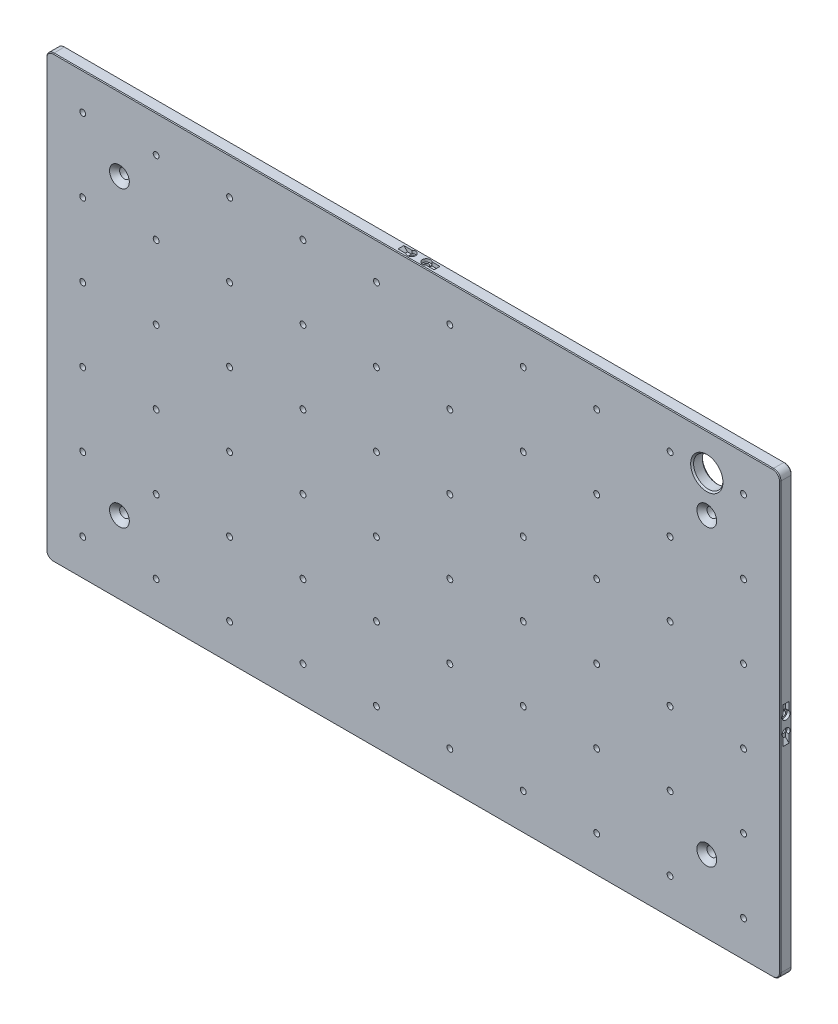
from build123d import *

# Parameters (mm, degrees)
SKETCH_1_W                  = 500
SKETCH_1_H                  = 300
EXTRUDE_1_DEPTH             = 8
HOLE_WIZARD_1_D             = 4
PATTERN_LINEAR_1_COUNT      = 10
PATTERN_LINEAR_1_PITCH      = 50
PATTERN_LINEAR_1_COUNT_DIR2 = 6
PATTERN_LINEAR_1_PITCH_DIR2 = 50
HOLE_WIZARD_2_D             = 6.6
HOLE_WIZARD_2_CSINK_D       = 13.44
HOLE_WIZARD_2_CSINK_ANGLE   = 90
PATTERN_LINEAR_2_COUNT      = 2
PATTERN_LINEAR_2_PITCH      = 400
PATTERN_LINEAR_2_COUNT_DIR2 = 2
PATTERN_LINEAR_2_PITCH_DIR2 = 200
HOLE_WIZARD_3_D             = 20
CHAMFER_1_SIZE              = 1
SKETCH_10_W                 = 1.6
SKETCH_10_H                 = 15
SKETCH_11_W                 = 6.5
SKETCH_11_H                 = 6.5
CUT_EXTRUDE_1_DEPTH         = 12
SKETCH_13_W                 = 2.7
SKETCH_13_H                 = 2
SKETCH_15_W                 = 3
SKETCH_15_H                 = 4
CUT_EXTRUDE_3_DEPTH         = 2.5
CHAMFER_3_SIZE              = 2.5
CHAMFER_3_OF_MIRROR_14_SIZE = 2.5
HOLE_WIZARD_6_D             = 5.4
HOLE_WIZARD_6_DEPTH         = 2
HOLE_WIZARD_7_D             = 3.2
HOLE_WIZARD_7_DEPTH         = 15
SKETCH_21_W                 = 3
SKETCH_21_H                 = 4
CUT_EXTRUDE_4_DEPTH         = 2.5
CHAMFER_4_SIZE              = 2.5
SKETCH_22_W                 = 6.5
SKETCH_22_H                 = 6.5
CUT_EXTRUDE_5_DEPTH         = 12
SKETCH_24_R                 = 1.6
CUT_EXTRUDE_6_DEPTH         = 15
HOLE_WIZARD_8_D             = 5.4
HOLE_WIZARD_8_DEPTH         = 2
SKETCH_27_W                 = 4
SKETCH_27_H                 = 3
CUT_EXTRUDE_7_DEPTH         = 2.5
CHAMFER_5_SIZE              = 2.5
SKETCH_28_W                 = 6.5
SKETCH_28_H                 = 6.5
CUT_EXTRUDE_9_DEPTH         = 12
HOLE_WIZARD_9_D             = 5.4
HOLE_WIZARD_9_DEPTH         = 2
HOLE_WIZARD_10_D            = 3.2
HOLE_WIZARD_10_DEPTH        = 15
SKETCH_34_W                 = 4
SKETCH_34_H                 = 3
CUT_EXTRUDE_10_DEPTH        = 2.5
CHAMFER_6_SIZE              = 2.5
SKETCH_36_W                 = 6.5
SKETCH_36_H                 = 6.5
CUT_EXTRUDE_11_DEPTH        = 12
FILLET_2_R                  = 5
CHAMFER_7_SIZE              = 0.5


with BuildPart() as part:
    # 草图1 → 凸台-拉伸1 (new body)
    with BuildSketch(Plane.XY):
        Rectangle(SKETCH_1_W, SKETCH_1_H)
    extrude(amount=EXTRUDE_1_DEPTH)

    # 孔1 (through all)
    with Locations(Plane.XY.offset(8)):
        with Locations((-225, -125)):
            hole_wizard_1 = Hole(HOLE_WIZARD_1_D / 2)

    # 阵列(线性)1: Hole Wizard 1 10 × 6
    with Locations(*[(i * PATTERN_LINEAR_1_PITCH, j * PATTERN_LINEAR_1_PITCH_DIR2, 0) for i in range(PATTERN_LINEAR_1_COUNT) for j in range(PATTERN_LINEAR_1_COUNT_DIR2) if (i, j) != (0, 0)]):
        add(hole_wizard_1, mode=Mode.SUBTRACT)

    # 孔2 (through all)
    with Locations(Plane.XY.offset(8)):
        with Locations((-200, 100)):
            hole_wizard_2 = CounterSinkHole(HOLE_WIZARD_2_D / 2, HOLE_WIZARD_2_CSINK_D / 2, counter_sink_angle=HOLE_WIZARD_2_CSINK_ANGLE)

    # 阵列(线性)2: Hole Wizard 2 2 × 2
    with Locations(*[(i * PATTERN_LINEAR_2_PITCH, -j * PATTERN_LINEAR_2_PITCH_DIR2, 0) for i in range(PATTERN_LINEAR_2_COUNT) for j in range(PATTERN_LINEAR_2_COUNT_DIR2) if (i, j) != (0, 0)]):
        add(hole_wizard_2, mode=Mode.SUBTRACT)

    # 孔3 (through all)
    with Locations(Plane.XY.offset(8)):
        with Locations((200, 125)):
            Hole(HOLE_WIZARD_3_D / 2)

    # 倒角1
    chamfer_1_edges = [part.edges().sort_by_distance(p)[0] for p in [
        (210, 125, 8),
        (210, 125, 0),
    ]]
    chamfer(chamfer_1_edges, length=CHAMFER_1_SIZE)


with BuildPart() as body_2:
    # Split Bodies 1: the piece on the far side of the plane
    add(part.part)
    split(bisect_by=Plane(origin=(0, 0, 0), x_dir=(0, 0, 1), z_dir=(1, 0, 0)), keep=Keep.BOTTOM)


with BuildPart() as part_1:
    add(part.part)

    # Split Bodies 1
    split(bisect_by=Plane(origin=(0, 0, 0), x_dir=(0, 0, 1), z_dir=(1, 0, 0)), keep=Keep.TOP)


with BuildPart() as body_3:
    # Split Bodies 2: the piece on the far side of the plane
    add(part_1.part)
    split(bisect_by=Plane.ZX, keep=Keep.BOTTOM)


with BuildPart() as part_2:
    add(part_1.part)

    # Split Bodies 2
    split(bisect_by=Plane.ZX, keep=Keep.TOP)


with BuildPart() as body_4:
    # Split Bodies 3: the piece on the far side of the plane
    add(body_2.part)
    split(bisect_by=Plane.ZX, keep=Keep.BOTTOM)


with BuildPart() as body_2_1:
    add(body_2.part)

    # Split Bodies 3
    split(bisect_by=Plane.ZX, keep=Keep.TOP)

    # 草图10 → 孔4 (revolve, cut)
    with BuildSketch(Plane(origin=(-5, 150, 4), x_dir=(0, 0, 1), z_dir=(1, 0, 0))):
        with Locations((0.8, 7.5)):
            Rectangle(SKETCH_10_W, SKETCH_10_H)
    hole_wizard_4 = revolve(axis=Axis((-5, 40, 4), (0, 1, 0)), mode=Mode.SUBTRACT)

    # 草图11 → 切除-拉伸1 (cut)
    with BuildSketch(Plane(origin=(0, 0, 0), x_dir=(0, 0, -1), z_dir=(1, 0, 0))):
        with Locations((-4, 143)):
            Rectangle(SKETCH_11_W, SKETCH_11_H)
    cut_extrude_1 = extrude(amount=-CUT_EXTRUDE_1_DEPTH, mode=Mode.SUBTRACT)

    # Combine 1: union part
    add(part_2.part)

    # 镜向1: 孔4, 切除-拉伸1 across plane
    add(hole_wizard_4.mirror(Plane(origin=(0, 0, 0), x_dir=(0, 0, 1), z_dir=(1, 0, 0))), mode=Mode.SUBTRACT)
    add(cut_extrude_1.mirror(Plane(origin=(0, 0, 0), x_dir=(0, 0, 1), z_dir=(1, 0, 0))), mode=Mode.SUBTRACT)

    # 草图13 → 孔5 (revolve, cut)
    with BuildSketch(Plane(origin=(-5, 150, 4), x_dir=(0, 0, 1), z_dir=(1, 0, 0))):
        with Locations((1.35, 1)):
            Rectangle(SKETCH_13_W, SKETCH_13_H)
    hole_wizard_5 = revolve(axis=Axis((-5, 40, 4), (0, 1, 0)), mode=Mode.SUBTRACT)

    # 草图15 → 切除-拉伸3 (cut)
    with BuildSketch(Plane(origin=(0, 150, 0), x_dir=(1, 0, 0), z_dir=(0, 1, 0))):
        with Locations((-8.313835715, -4)):
            Rectangle(SKETCH_15_W, SKETCH_15_H)
    cut_extrude_3 = extrude(amount=-CUT_EXTRUDE_3_DEPTH, mode=Mode.SUBTRACT)

    # 倒角3
    chamfer_3_edges = [body_2_1.edges().sort_by_distance(p)[0] for p in [
        (-9.813835715, 150, 4),
    ]]
    chamfer(chamfer_3_edges, length=CHAMFER_3_SIZE - 0.0001)  # a hair under: the kernel refuses the full size

    # 镜向14: 孔5, 切除-拉伸3 across plane
    add(hole_wizard_5.mirror(Plane(origin=(0, 0, 0), x_dir=(0, 0, 1), z_dir=(1, 0, 0))), mode=Mode.SUBTRACT)
    add(cut_extrude_3.mirror(Plane(origin=(0, 0, 0), x_dir=(0, 0, 1), z_dir=(1, 0, 0))), mode=Mode.SUBTRACT)

    # 倒角3 of 镜向14
    chamfer_3_of_mirror_14_edges = [body_2_1.edges().sort_by_distance(p)[0] for p in [
        (9.813835715, 150, 4),
    ]]
    chamfer(chamfer_3_of_mirror_14_edges, length=CHAMFER_3_OF_MIRROR_14_SIZE - 0.0001)  # a hair under: the kernel refuses the full size


with BuildPart() as body_4_1:
    add(body_4.part)

    # Combine 4: union body 3, body 2
    add(body_3.part)
    add(body_2_1.part)

    # 孔6
    with Locations(Plane(origin=(0, -150, 0), x_dir=(-1, 0, 0), z_dir=(0, -1, 0))):
        with Locations((-5, -4), (5, -4)):
            Hole(HOLE_WIZARD_6_D / 2, depth=HOLE_WIZARD_6_DEPTH)

    # 孔7
    with Locations(Plane(origin=(0, -150, 0), x_dir=(-1, 0, 0), z_dir=(0, -1, 0))):
        with Locations((5, -4), (-5, -4)):
            Hole(HOLE_WIZARD_7_D / 2, depth=HOLE_WIZARD_7_DEPTH)

    # 草图21 → 切除-拉伸4 (cut)
    with BuildSketch(Plane.XZ.offset(150)):
        with Locations((-8.313835715, 4)):
            Rectangle(SKETCH_21_W, SKETCH_21_H)
        with Locations((8.313835715, 4)):
            Rectangle(SKETCH_21_W, SKETCH_21_H)
    extrude(amount=-CUT_EXTRUDE_4_DEPTH, mode=Mode.SUBTRACT)

    # 倒角4
    chamfer_4_edges = [body_4_1.edges().sort_by_distance(p)[0] for p in [
        (9.813835715, -150, 4),
        (-9.813835715, -150, 4),
    ]]
    chamfer(chamfer_4_edges, length=CHAMFER_4_SIZE - 0.0001)  # a hair under: the kernel refuses the full size

    # 草图22 → 切除-拉伸5 (cut, symmetric)
    with BuildSketch(Plane(origin=(0, 0, 0), x_dir=(0, 0, -1), z_dir=(1, 0, 0))):
        with Locations((-4, -143)):
            Rectangle(SKETCH_22_W, SKETCH_22_H)
    extrude(amount=CUT_EXTRUDE_5_DEPTH, both=True, mode=Mode.SUBTRACT)

    # 草图24 → 切除-拉伸6 (cut)
    with BuildSketch(Plane.ZY.offset(250)):
        with Locations((4, 5)):
            Circle(SKETCH_24_R)
        with Locations((4, -5)):
            Circle(SKETCH_24_R)
    extrude(amount=-CUT_EXTRUDE_6_DEPTH, mode=Mode.SUBTRACT)

    # 孔8
    with Locations(Plane.ZY.offset(250)):
        with Locations((4, 5), (4, -5)):
            Hole(HOLE_WIZARD_8_D / 2, depth=HOLE_WIZARD_8_DEPTH)

    # 草图27 → 切除-拉伸7 (cut)
    with BuildSketch(Plane.ZY.offset(250)):
        with Locations((4, -8.313835715)):
            Rectangle(SKETCH_27_W, SKETCH_27_H)
        with Locations((4, 8.313835715)):
            Rectangle(SKETCH_27_W, SKETCH_27_H)
    extrude(amount=-CUT_EXTRUDE_7_DEPTH, mode=Mode.SUBTRACT)

    # 倒角5
    chamfer_5_edges = [body_4_1.edges().sort_by_distance(p)[0] for p in [
        (-250, -9.813835715, 4),
        (-250, 9.813835715, 4),
    ]]
    chamfer(chamfer_5_edges, length=CHAMFER_5_SIZE - 0.0001)  # a hair under: the kernel refuses the full size

    # 草图28 → 切除-拉伸9 (cut, symmetric)
    with BuildSketch(Plane(origin=(0, 0, 0), x_dir=(1, 0, 0), z_dir=(0, 1, 0))):
        with Locations((-243, -4)):
            Rectangle(SKETCH_28_W, SKETCH_28_H)
    extrude(amount=CUT_EXTRUDE_9_DEPTH, both=True, mode=Mode.SUBTRACT)

    # 孔9
    with Locations(Plane(origin=(250, 0, 0), x_dir=(0, 0, -1), z_dir=(1, 0, 0))):
        with Locations((-4, 5), (-4, -5)):
            Hole(HOLE_WIZARD_9_D / 2, depth=HOLE_WIZARD_9_DEPTH)

    # 孔10
    with Locations(Plane(origin=(250, 0, 0), x_dir=(0, 0, -1), z_dir=(1, 0, 0))):
        with Locations((-4, 5), (-4, -5)):
            Hole(HOLE_WIZARD_10_D / 2, depth=HOLE_WIZARD_10_DEPTH)

    # 草图34 → 切除-拉伸10 (cut)
    with BuildSketch(Plane(origin=(250, 0, 0), x_dir=(0, 0, -1), z_dir=(1, 0, 0))):
        with Locations((-4, 8.313835715)):
            Rectangle(SKETCH_34_W, SKETCH_34_H)
        with Locations((-4, -8.313835715)):
            Rectangle(SKETCH_34_W, SKETCH_34_H)
    extrude(amount=-CUT_EXTRUDE_10_DEPTH, mode=Mode.SUBTRACT)

    # 倒角6
    chamfer_6_edges = [body_4_1.edges().sort_by_distance(p)[0] for p in [
        (250, -9.813835715, 4),
        (250, 9.813835715, 4),
    ]]
    chamfer(chamfer_6_edges, length=CHAMFER_6_SIZE - 0.0001)  # a hair under: the kernel refuses the full size

    # 草图36 → 切除-拉伸11 (cut, symmetric)
    with BuildSketch(Plane(origin=(0, 0, 0), x_dir=(1, 0, 0), z_dir=(0, 1, 0))):
        with Locations((243, -4)):
            Rectangle(SKETCH_36_W, SKETCH_36_H)
    extrude(amount=CUT_EXTRUDE_11_DEPTH, both=True, mode=Mode.SUBTRACT)

    # 圆角2
    fillet_2_edges = [body_4_1.edges().sort_by_distance(p)[0] for p in [
        (-250, -150, 4),
        (250, -150, 4),
        (250, 150, 4),
        (-250, 150, 4),
    ]]
    fillet(fillet_2_edges, radius=FILLET_2_R)

    # 倒角7
    chamfer_7_edges = [body_4_1.edges().sort_by_distance(p)[0] for p in [
        (-250, 0, 8),
        (-250, 0, 0),
        (0, 150, 0),
        (250, 0, 0),
        (0, -150, 0),
        (248.535533906, 148.535533906, 0),
        (248.535533906, -148.535533906, 0),
        (-248.535533906, -148.535533906, 0),
        (-248.535533906, 148.535533906, 0),
        (0, 150, 8),
        (0, -150, 8),
        (250, 0, 8),
        (248.535533906, 148.535533906, 8),
        (248.535533906, -148.535533906, 8),
        (-248.535533906, -148.535533906, 8),
        (-248.535533906, 148.535533906, 8),
    ]]
    chamfer(chamfer_7_edges, length=CHAMFER_7_SIZE)


solid = body_4_1.part
